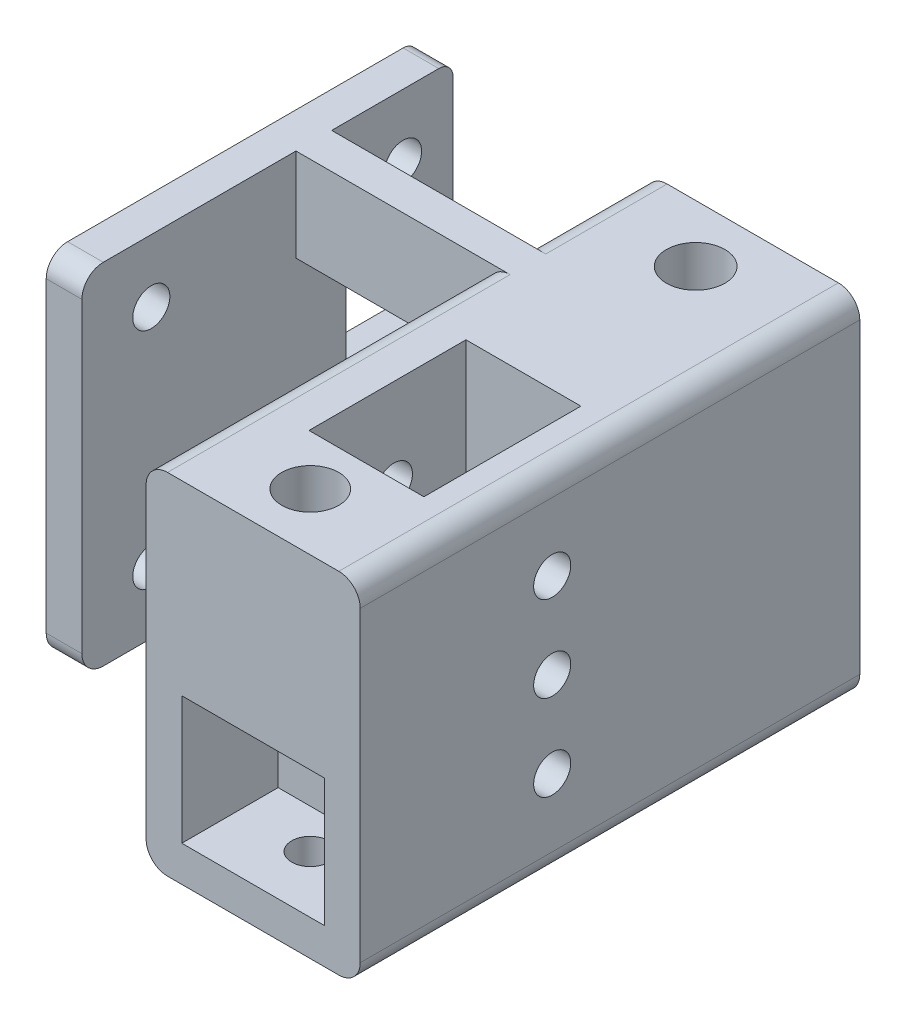
from build123d import *

# Parameters (mm, degrees)
SKETCH1_R            = 11
BOSS_EXTRUDE1_DEPTH  = 3
SKETCH2_R            = 5.25
CUT_EXTRUDE1_DEPTH   = 16.842979518
SKETCH3_R            = 1.5
SKETCH3_R_2          = 1.545696852
CUT_EXTRUDE2_DEPTH   = 16.842979518
SKETCH4_W            = 27.859055967
SKETCH4_H            = 2.012088195
BOSS_EXTRUDE3_DEPTH  = 11
SKETCH5_R            = 5.25
CUT_EXTRUDE3_DEPTH   = 31.019585245
SKETCH6_R            = 1.5
SKETCH6_R_2          = 1.545696852
CUT_EXTRUDE4_DEPTH   = 31.101943449
CUT_EXTRUDE5_DEPTH   = 10
BOSS_EXTRUDE5_START  = 5
SKETCH10_R           = 1.5
SKETCH10_R_2         = 5.25
SKETCH10_R_3         = 1.545696852
BOSS_EXTRUDE5_DEPTH  = 5
SKETCH11_W           = 18
SKETCH11_H           = 7.012088195
BOSS_EXTRUDE7_DEPTH  = 13
SKETCH13_W           = 6
SKETCH13_H           = 8
BOSS_EXTRUDE8_DEPTH  = 10
SKETCH14_W           = 18
SKETCH14_H           = 1.5
CUT_EXTRUDE6_DEPTH   = 10
SKETCH15_W           = 8
SKETCH15_H           = 8
BOSS_EXTRUDE9_DEPTH  = 30
SKETCH16_W           = 2
SKETCH16_H           = 8
BOSS_EXTRUDE10_DEPTH = 10
SKETCH18_W           = 47.012088195
SKETCH18_H           = 3.5
BOSS_EXTRUDE11_DEPTH = 8
SKETCH19_W           = 47.012088195
SKETCH19_H           = 5
BOSS_EXTRUDE12_DEPTH = 8
SKETCH20_R           = 2.75
CUT_EXTRUDE7_DEPTH   = 8
SKETCH21_W           = 30
SKETCH21_H           = 16.5
CUT_EXTRUDE8_DEPTH   = 8
BOSS_EXTRUDE13_DEPTH = 2
FILLET4_R            = 2
SKETCH24_W           = 18
SKETCH24_H           = 7.012088195
BOSS_EXTRUDE14_DEPTH = 13.5
SKETCH25_W           = 10.228009428
SKETCH25_H           = 18.5
BOSS_EXTRUDE15_DEPTH = 8
SKETCH26_R           = 2.6
CUT_EXTRUDE9_DEPTH   = 8
FILLET6_R            = 2
SKETCH27_W           = 8.492399871
SKETCH27_H           = 8.837619377
BOSS_EXTRUDE16_DEPTH = 8
SKETCH28_W           = 9.389970589
SKETCH28_H           = 7.249609645
BOSS_EXTRUDE17_DEPTH = 8
SKETCH30_W           = 8
SKETCH30_H           = 2
BOSS_EXTRUDE19_DEPTH = 8
SKETCH31_W           = 8
SKETCH31_H           = 2
BOSS_EXTRUDE20_DEPTH = 8
SKETCH32_W           = 8
SKETCH32_H           = 18.5
BOSS_EXTRUDE22_DEPTH = 5
SKETCH33_W           = 8
SKETCH33_H           = 18.5
BOSS_EXTRUDE23_DEPTH = 5
SKETCH34_R           = 2.6
CUT_EXTRUDE11_DEPTH  = 46.033658305
SKETCH35_R           = 2.6
CUT_EXTRUDE12_DEPTH  = 46.033658305
SKETCH36_W           = 8
SKETCH36_H           = 0.228009428
CUT_EXTRUDE13_DEPTH  = 57.389541409
SKETCH37_W           = 3
SKETCH37_H           = 18.5
CUT_EXTRUDE14_DEPTH  = 15
SKETCH38_W           = 3
SKETCH38_H           = 18.5
CUT_EXTRUDE15_DEPTH  = 15
FILLET9_R            = 2
SKETCH39_W           = 8.423355969
SKETCH39_H           = 9.735190095
SKETCH39_W_2         = 8.630487673
SKETCH39_H_2         = 8.354312067
BOSS_EXTRUDE24_DEPTH = 8
SKETCH40_R           = 2.6
CUT_EXTRUDE16_DEPTH  = 8
SKETCH41_W           = 3
SKETCH41_H           = 9.735190095
CUT_EXTRUDE18_DEPTH  = 9
SKETCH42_W           = 3
SKETCH42_H           = 8.354312067
CUT_EXTRUDE19_DEPTH  = 9
SKETCH43_R           = 2.6
CUT_EXTRUDE20_DEPTH  = 9
SKETCH48_W           = 22
SKETCH48_H           = 13
BOSS_EXTRUDE26_DEPTH = 5
SKETCH49_W           = 22
SKETCH49_H           = 13
BOSS_EXTRUDE27_DEPTH = 5
SKETCH50_W           = 5
SKETCH50_H           = 49
BOSS_EXTRUDE28_DEPTH = 15
SKETCH51_W           = 55
SKETCH51_H           = 5
BOSS_EXTRUDE29_DEPTH = 42.8
SKETCH52_W           = 55
SKETCH52_H           = 5
BOSS_EXTRUDE30_DEPTH = 47.8
SKETCH53_W           = 55
SKETCH53_H           = 5
BOSS_EXTRUDE31_DEPTH = 47.8
SKETCH55_W           = 15
SKETCH55_H           = 47.8
CUT_EXTRUDE21_DEPTH  = 128.298389621
SKETCH57_W           = 47.8
SKETCH57_H           = 52.8
BOSS_EXTRUDE32_DEPTH = 5
SKETCH58_R           = 11.5
CUT_EXTRUDE25_DEPTH  = 111.385370407
SKETCH61_W           = 25
SKETCH61_H           = 27.8
CUT_EXTRUDE26_DEPTH  = 128.298389621
SKETCH62_R           = 1.75
CUT_EXTRUDE28_DEPTH  = 108.656537191
SKETCH63_R           = 1.75
CUT_EXTRUDE29_DEPTH  = 108.656537191
SKETCH64_R           = 1.75
CUT_EXTRUDE30_DEPTH  = 108.656537191
SKETCH65_R           = 1.75
CUT_EXTRUDE31_DEPTH  = 108.656537191
SKETCH67_W           = 5
SKETCH67_H           = 49
BOSS_EXTRUDE33_DEPTH = 5
SKETCH68_W           = 15
SKETCH68_H           = 17.012088195
SKETCH68_H_2         = 47.8
BOSS_EXTRUDE34_DEPTH = 15
BOSS_EXTRUDE36_DEPTH = 15
SKETCH70_R           = 4.1
CUT_EXTRUDE32_DEPTH  = 10
SKETCH72_W           = 18
SKETCH72_H           = 22
CUT_EXTRUDE33_DEPTH  = 139.003188369
FILLET10_R           = 4
FILLET12_R           = 4
FILLET13_R           = 4
SKETCH77_W           = 36.444620244
SKETCH77_H           = 50.862269336
CUT_EXTRUDE38_DEPTH  = 122.625059146
SKETCH78_W           = 45
SKETCH78_H           = 47.8
CUT_EXTRUDE39_DEPTH  = 119.630223805
SKETCH79_W           = 31.43111071
SKETCH79_H           = 18.51831177
CUT_EXTRUDE40_DEPTH  = 110.889216941
SKETCH80_W           = 62
SKETCH80_H           = 47.8
CUT_EXTRUDE41_DEPTH  = 110.889216941
SKETCH81_R           = 11
CUT_EXTRUDE42_DEPTH  = 86.776387285
SKETCH85_W           = 30
SKETCH85_H           = 49
BOSS_EXTRUDE37_DEPTH = 17
SKETCH86_W           = 30
SKETCH86_H           = 49
BOSS_EXTRUDE39_DEPTH = 70
SKETCH87_R           = 4.1
SKETCH87_R_2         = 4
SKETCH87_W           = 16.099872219
SKETCH87_H           = 22
CUT_EXTRUDE43_DEPTH  = 70
FILLET17_R           = 3
SKETCH89_W           = 5
SKETCH89_H           = 49
BOSS_EXTRUDE40_DEPTH = 30
SKETCH92_R           = 2.6
CUT_EXTRUDE44_DEPTH  = 10
FILLET18_R           = 3
SKETCH93_W           = 20
SKETCH93_H           = 17.946512219
CUT_EXTRUDE45_DEPTH  = 17.8
SKETCH98_R           = 2.6
CUT_EXTRUDE46_DEPTH  = 37.8
SKETCH99_R           = 2.6
CUT_EXTRUDE48_DEPTH  = 37.8
SKETCH100_R          = 2.6
CUT_EXTRUDE49_DEPTH  = 37.8
SKETCH102_W          = 20
SKETCH102_H          = 17.9
CUT_EXTRUDE50_DEPTH  = 13.5
SKETCH103_W          = 11.73949016
SKETCH103_H          = 10.259722493
BOSS_EXTRUDE41_DEPTH = 5
SKETCH104_W          = 13.021955472
SKETCH104_H          = 9.865117781
BOSS_EXTRUDE42_DEPTH = 5
SKETCH105_R          = 2.6
CUT_EXTRUDE51_DEPTH  = 15


with BuildPart() as part:
    # Sketch1 → Boss-Extrude1 (new body)
    with BuildSketch(Plane.XY):
        Circle(SKETCH1_R)
    extrude(amount=BOSS_EXTRUDE1_DEPTH)

    # Sketch2 → Cut-Extrude1 (cut, through all)
    with BuildSketch(Plane.XY.offset(3)):
        Circle(SKETCH2_R)
    extrude(amount=-CUT_EXTRUDE1_DEPTH, mode=Mode.SUBTRACT)

    # Sketch3 → Cut-Extrude2 (cut, through all)
    with BuildSketch(Plane.XY.offset(3)):
        with Locations((0, 8.5)):
            Circle(SKETCH3_R)
        with Locations((-8.5, 0)):
            Circle(SKETCH3_R)
        with Locations((0, -8.5)):
            Circle(SKETCH3_R_2)
        with Locations((8.5, 0)):
            Circle(SKETCH3_R)
    extrude(amount=-CUT_EXTRUDE2_DEPTH, mode=Mode.SUBTRACT)

    # Sketch4 → Boss-Extrude3 (add, symmetric)
    with BuildSketch(Plane(origin=(0, 0, 0), x_dir=(1, 0, 0), z_dir=(0, 1, 0))):
        with Locations((13.929527984, -1.993955902)):
            Rectangle(SKETCH4_W, SKETCH4_H)
    extrude(amount=BOSS_EXTRUDE3_DEPTH, both=True)

    # Sketch5 → Cut-Extrude3 (cut, through all)
    with BuildSketch(Plane(origin=(0, 0, 0.987911805), x_dir=(-1, 0, 0), z_dir=(0, 0, -1))):
        with Locations(Location((0, 0, 0), (0, 0, 180))):
            Circle(SKETCH5_R)
    extrude(amount=-CUT_EXTRUDE3_DEPTH, mode=Mode.SUBTRACT)

    # Sketch6 → Cut-Extrude4 (cut, through all)
    with BuildSketch(Plane(origin=(0, 0, 0), x_dir=(-1, 0, 0), z_dir=(0, 0, -1))):
        with Locations(Location((-8.5, 0, 0), (0, 0, 180))):
            Circle(SKETCH6_R)
        with Locations(Location((0, 8.5, 0), (0, 0, 180))):
            Circle(SKETCH6_R)
        with Locations(Location((0, -8.5, 0), (0, 0, 180))):
            Circle(SKETCH6_R_2)
    extrude(amount=-CUT_EXTRUDE4_DEPTH, mode=Mode.SUBTRACT)

    # Sketch7 → Cut-Extrude5 (cut)
    with BuildSketch(Plane(origin=(0, 0, 0.987911805), x_dir=(-1, 0, 0), z_dir=(0, 0, -1))):
        Polygon((-24, 11), (-27.859055967, 11), (-27.859055967, -11), (-24, -11), (-24, 0), align=None)
    extrude(amount=-CUT_EXTRUDE5_DEPTH, mode=Mode.SUBTRACT)

    # Sketch10 → Boss-Extrude5 (add)
    with BuildSketch(Plane.XY.offset(3).offset(BOSS_EXTRUDE5_START)):
        with BuildLine():
            Line((0, -11), (24, -11))
            Line((24, -11), (24, 11))
            Line((24, 11), (0, 11))
            ThreePointArc((0, 11), (-11, 0), (0, -11))
        make_face()
        with Locations((0, 8.5)):
            Circle(SKETCH10_R, mode=Mode.SUBTRACT)
        Circle(SKETCH10_R_2, mode=Mode.SUBTRACT)
        with Locations((0, -8.5)):
            Circle(SKETCH10_R_3, mode=Mode.SUBTRACT)
        with Locations((8.5, 0)):
            Circle(SKETCH10_R, mode=Mode.SUBTRACT)
        with Locations((-8.5, 0)):
            Circle(SKETCH10_R, mode=Mode.SUBTRACT)
    extrude(amount=-BOSS_EXTRUDE5_DEPTH)

    # Sketch11 → Boss-Extrude7 (add)
    with BuildSketch(Plane.XZ.offset(11)):
        with Locations((15, 4.493955902)):
            Rectangle(SKETCH11_W, SKETCH11_H)
    extrude(amount=BOSS_EXTRUDE7_DEPTH)

    # Sketch13 → Boss-Extrude8 (add)
    with BuildSketch(Plane(origin=(0, 0, 0.987911805), x_dir=(-1, 0, 0), z_dir=(0, 0, -1))):
        with Locations((-21, -18.5)):
            Rectangle(SKETCH13_W, SKETCH13_H)
    extrude(amount=BOSS_EXTRUDE8_DEPTH)

    # Sketch14 → Cut-Extrude6 (cut)
    with BuildSketch(Plane(origin=(0, 0, 0.987911805), x_dir=(-1, 0, 0), z_dir=(0, 0, -1))):
        with Locations((-15, -23.25)):
            Rectangle(SKETCH14_W, SKETCH14_H)
    extrude(amount=-CUT_EXTRUDE6_DEPTH, mode=Mode.SUBTRACT)

    # Sketch15 → Boss-Extrude9 (add)
    with BuildSketch(Plane.XY.offset(8)):
        with Locations((20, -18.5)):
            Rectangle(SKETCH15_W, SKETCH15_H)
    extrude(amount=BOSS_EXTRUDE9_DEPTH)

    # Sketch16 → Boss-Extrude10 (add)
    with BuildSketch(Plane(origin=(0, 0, 0.987911805), x_dir=(-1, 0, 0), z_dir=(0, 0, -1))):
        with Locations((-17, -18.5)):
            Rectangle(SKETCH16_W, SKETCH16_H)
    extrude(amount=BOSS_EXTRUDE10_DEPTH)

    # Sketch18 → Boss-Extrude11 (add)
    with BuildSketch(Plane(origin=(24, 0, 0), x_dir=(0, 0, -1), z_dir=(1, 0, 0))):
        with Locations((-14.493955902, -12.75)):
            Rectangle(SKETCH18_W, SKETCH18_H)
    extrude(amount=-BOSS_EXTRUDE11_DEPTH)

    # Sketch19 → Boss-Extrude12 (add)
    with BuildSketch(Plane(origin=(24, 0, 0), x_dir=(0, 0, -1), z_dir=(1, 0, 0))):
        with Locations((-14.493955902, -8.5)):
            Rectangle(SKETCH19_W, SKETCH19_H)
    extrude(amount=-BOSS_EXTRUDE12_DEPTH)

    # Sketch20 → Cut-Extrude7 (cut)
    with BuildSketch(Plane(origin=(24, 0, 0), x_dir=(0, 0, -1), z_dir=(1, 0, 0))):
        with Locations((2.797809472, -17)):
            Circle(SKETCH20_R)
    extrude(amount=-CUT_EXTRUDE7_DEPTH, mode=Mode.SUBTRACT)

    # Sketch21 → Cut-Extrude8 (cut)
    with BuildSketch(Plane(origin=(24, 0, 0), x_dir=(0, 0, -1), z_dir=(1, 0, 0))):
        with Locations((-23, -14.25)):
            Rectangle(SKETCH21_W, SKETCH21_H)
    extrude(amount=-CUT_EXTRUDE8_DEPTH, mode=Mode.SUBTRACT)

    # Sketch22 → Boss-Extrude13 (add)
    with BuildSketch(Plane.XZ.offset(22.5)):
        Polygon((6, 8), (24, 8), (24, -9.012088195), (16, -9.012088195), (16, 0.987911805), (6, 0.987911805), align=None)
    extrude(amount=BOSS_EXTRUDE13_DEPTH)

    # Fillet4
    fillet4_edges = [part.edges().sort_by_distance(p)[0] for p in [
        (20, -6, -9.012088195),
        (20, -24.5, -9.012088195),
    ]]
    fillet(fillet4_edges, radius=FILLET4_R)

    # Sketch24 → Boss-Extrude14 (add)
    with BuildSketch(Plane(origin=(0, 11, 0), x_dir=(1, 0, 0), z_dir=(0, 1, 0))):
        with Locations((15, -4.493955902)):
            Rectangle(SKETCH24_W, SKETCH24_H)
    extrude(amount=BOSS_EXTRUDE14_DEPTH)

    # Sketch25 → Boss-Extrude15 (add)
    with BuildSketch(Plane(origin=(24, 0, 0), x_dir=(0, 0, -1), z_dir=(1, 0, 0))):
        with Locations((4.126092909, 15.25)):
            Rectangle(SKETCH25_W, SKETCH25_H)
    extrude(amount=-BOSS_EXTRUDE15_DEPTH)

    # Sketch26 → Cut-Extrude9 (cut)
    with BuildSketch(Plane(origin=(24, 0, 0), x_dir=(0, 0, -1), z_dir=(1, 0, 0))):
        with Locations((2.797809472, 17)):
            Circle(SKETCH26_R)
    extrude(amount=-CUT_EXTRUDE9_DEPTH, mode=Mode.SUBTRACT)

    # Fillet6
    fillet6_edges = [part.edges().sort_by_distance(p)[0] for p in [
        (20, 24.5, -9.240097623),
        (20, 6, -9.240097623),
    ]]
    fillet(fillet6_edges, radius=FILLET6_R)

    # Sketch27 → Boss-Extrude16 (add)
    with BuildSketch(Plane(origin=(24, 0, 0), x_dir=(0, 0, -1), z_dir=(1, 0, 0))):
        with Locations((2.277102445, 17.019321692)):
            Rectangle(SKETCH27_W, SKETCH27_H)
    extrude(amount=-BOSS_EXTRUDE16_DEPTH)

    # Sketch28 → Boss-Extrude17 (add)
    with BuildSketch(Plane(origin=(24, 0, 0), x_dir=(0, 0, -1), z_dir=(1, 0, 0))):
        with Locations((2.173536592, -16.501492431)):
            Rectangle(SKETCH28_W, SKETCH28_H)
    extrude(amount=-BOSS_EXTRUDE17_DEPTH)

    # Sketch30 → Boss-Extrude19 (add)
    with BuildSketch(Plane(origin=(0, 0, -9.240097623), x_dir=(-1, 0, 0), z_dir=(0, 0, -1))):
        with Locations((-20, 23.5)):
            Rectangle(SKETCH30_W, SKETCH30_H)
        with Locations((-20, 7)):
            Rectangle(SKETCH30_W, SKETCH30_H)
    extrude(amount=-BOSS_EXTRUDE19_DEPTH)

    # Sketch31 → Boss-Extrude20 (add)
    with BuildSketch(Plane(origin=(0, 0, -9.012088195), x_dir=(-1, 0, 0), z_dir=(0, 0, -1))):
        with Locations((-20, -7)):
            Rectangle(SKETCH31_W, SKETCH31_H)
        with Locations((-20, -23.5)):
            Rectangle(SKETCH31_W, SKETCH31_H)
    extrude(amount=-BOSS_EXTRUDE20_DEPTH)

    # Sketch32 → Boss-Extrude22 (add)
    with BuildSketch(Plane(origin=(0, 0, -9.240097623), x_dir=(-1, 0, 0), z_dir=(0, 0, -1))):
        with Locations((-20, 15.25)):
            Rectangle(SKETCH32_W, SKETCH32_H)
    extrude(amount=BOSS_EXTRUDE22_DEPTH)

    # Sketch33 → Boss-Extrude23 (add)
    with BuildSketch(Plane(origin=(0, 0, -9.012088195), x_dir=(-1, 0, 0), z_dir=(0, 0, -1))):
        with Locations((-20, -15.25)):
            Rectangle(SKETCH33_W, SKETCH33_H)
    extrude(amount=BOSS_EXTRUDE23_DEPTH)

    # Sketch34 → Cut-Extrude11 (cut, through all)
    with BuildSketch(Plane(origin=(24, 0, 0), x_dir=(0, 0, -1), z_dir=(1, 0, 0))):
        with Locations((6.012088195, 16.7)):
            Circle(SKETCH34_R)
    extrude(amount=-CUT_EXTRUDE11_DEPTH, mode=Mode.SUBTRACT)

    # Sketch35 → Cut-Extrude12 (cut, through all)
    with BuildSketch(Plane(origin=(24, 0, 0), x_dir=(0, 0, -1), z_dir=(1, 0, 0))):
        with Locations((6.012088195, -16.7)):
            Circle(SKETCH35_R)
    extrude(amount=-CUT_EXTRUDE12_DEPTH, mode=Mode.SUBTRACT)

    # Sketch36 → Cut-Extrude13 (cut, through all)
    with BuildSketch(Plane.XZ.offset(24.5)):
        with Locations((20, -14.126092909)):
            Rectangle(SKETCH36_W, SKETCH36_H)
    extrude(amount=-CUT_EXTRUDE13_DEPTH, mode=Mode.SUBTRACT)

    # Sketch37 → Cut-Extrude14 (cut)
    with BuildSketch(Plane(origin=(0, 0, -14.012088195), x_dir=(-1, 0, 0), z_dir=(0, 0, -1))):
        with Locations((-17.5, -15.25)):
            Rectangle(SKETCH37_W, SKETCH37_H)
    extrude(amount=-CUT_EXTRUDE14_DEPTH, mode=Mode.SUBTRACT)

    # Sketch38 → Cut-Extrude15 (cut)
    with BuildSketch(Plane(origin=(0, 0, -14.012088195), x_dir=(-1, 0, 0), z_dir=(0, 0, -1))):
        with Locations((-17.5, 15.25)):
            Rectangle(SKETCH38_W, SKETCH38_H)
    extrude(amount=-CUT_EXTRUDE15_DEPTH, mode=Mode.SUBTRACT)

    # Fillet9
    fillet9_edges = [part.edges().sort_by_distance(p)[0] for p in [
        (21.5, -24.5, -14.012088195),
        (21.5, 6, -14.012088195),
        (21.5, 24.5, -14.012088195),
        (21.5, -6, -14.012088195),
    ]]
    fillet(fillet9_edges, radius=FILLET9_R)

    # Sketch39 → Boss-Extrude24 (add)
    with BuildSketch(Plane(origin=(24, 0, 0), x_dir=(0, 0, -1), z_dir=(1, 0, 0))):
        with Locations((6.768936723, 16.708624135)):
            Rectangle(SKETCH39_W, SKETCH39_H)
        with Locations((6.11301966, -16.846711938)):
            Rectangle(SKETCH39_W_2, SKETCH39_H_2)
    extrude(amount=-BOSS_EXTRUDE24_DEPTH)

    # Sketch40 → Cut-Extrude16 (cut)
    with BuildSketch(Plane(origin=(24, 0, 0), x_dir=(0, 0, -1), z_dir=(1, 0, 0))):
        with Locations((7, 15.7)):
            Circle(SKETCH40_R)
    extrude(amount=-CUT_EXTRUDE16_DEPTH, mode=Mode.SUBTRACT)

    # Sketch41 → Cut-Extrude18 (cut)
    with BuildSketch(Plane(origin=(0, 0, -10.980614707), x_dir=(-1, 0, 0), z_dir=(0, 0, -1))):
        with Locations((-17.5, 16.708624135)):
            Rectangle(SKETCH41_W, SKETCH41_H)
    extrude(amount=-CUT_EXTRUDE18_DEPTH, mode=Mode.SUBTRACT)

    # Sketch42 → Cut-Extrude19 (cut)
    with BuildSketch(Plane(origin=(0, 0, -10.428263496), x_dir=(-1, 0, 0), z_dir=(0, 0, -1))):
        with Locations((-17.5, -16.846711938)):
            Rectangle(SKETCH42_W, SKETCH42_H)
    extrude(amount=-CUT_EXTRUDE19_DEPTH, mode=Mode.SUBTRACT)

    # Sketch43 → Cut-Extrude20 (cut)
    with BuildSketch(Plane(origin=(24, 0, 0), x_dir=(0, 0, -1), z_dir=(1, 0, 0))):
        with Locations((7, -15.7)):
            Circle(SKETCH43_R)
    extrude(amount=-CUT_EXTRUDE20_DEPTH, mode=Mode.SUBTRACT)

    # Sketch48 → Boss-Extrude26 (add)
    with BuildSketch(Plane.XY.offset(8)):
        with Locations((35, -18)):
            Rectangle(SKETCH48_W, SKETCH48_H)
    extrude(amount=-BOSS_EXTRUDE26_DEPTH)

    # Sketch49 → Boss-Extrude27 (add)
    with BuildSketch(Plane.XY.offset(8)):
        with Locations((35, 18)):
            Rectangle(SKETCH49_W, SKETCH49_H)
    extrude(amount=-BOSS_EXTRUDE27_DEPTH)

    # Sketch50 → Boss-Extrude28 (add)
    with BuildSketch(Plane(origin=(46, 0, 0), x_dir=(0, 0, -1), z_dir=(1, 0, 0))):
        with Locations((-5.5, 0)):
            Rectangle(SKETCH50_W, SKETCH50_H)
    extrude(amount=BOSS_EXTRUDE28_DEPTH)

    # Sketch51 → Boss-Extrude29 (add)
    with BuildSketch(Plane.XY.offset(8)):
        with Locations((33.5, 22)):
            Rectangle(SKETCH51_W, SKETCH51_H)
    extrude(amount=BOSS_EXTRUDE29_DEPTH)

    # Sketch52 → Boss-Extrude30 (add)
    with BuildSketch(Plane.XZ.offset(-19.5)):
        with Locations((33.5, 53.3)):
            Rectangle(SKETCH52_W, SKETCH52_H)
    extrude(amount=-BOSS_EXTRUDE30_DEPTH)

    # Sketch53 → Boss-Extrude31 (add)
    with BuildSketch(Plane.XY.offset(55.8)):
        with Locations((33.5, 69.8)):
            Rectangle(SKETCH53_W, SKETCH53_H)
    extrude(amount=-BOSS_EXTRUDE31_DEPTH)

    # Sketch55 → Cut-Extrude21 (cut, through all)
    with BuildSketch(Plane(origin=(0, 72.3, 0), x_dir=(1, 0, 0), z_dir=(0, 1, 0))):
        with Locations((53.5, -31.9)):
            Rectangle(SKETCH55_W, SKETCH55_H)
    extrude(amount=-CUT_EXTRUDE21_DEPTH, mode=Mode.SUBTRACT)

    # Sketch57 → Boss-Extrude32 (add)
    with BuildSketch(Plane(origin=(46, 0, 0), x_dir=(0, 0, -1), z_dir=(1, 0, 0))):
        with Locations((-31.9, 45.9)):
            Rectangle(SKETCH57_W, SKETCH57_H)
    extrude(amount=BOSS_EXTRUDE32_DEPTH)

    # Sketch58 → Cut-Extrude25 (cut, through all)
    with BuildSketch(Plane(origin=(51, 0, 0), x_dir=(0, 0, -1), z_dir=(1, 0, 0))):
        with Locations((-29.4, 45.9)):
            Circle(SKETCH58_R)
    extrude(amount=-CUT_EXTRUDE25_DEPTH, mode=Mode.SUBTRACT)

    # Sketch61 → Cut-Extrude26 (cut, through all)
    with BuildSketch(Plane(origin=(0, 72.3, 0), x_dir=(1, 0, 0), z_dir=(0, 1, 0))):
        with Locations((28.5, -31.9)):
            Rectangle(SKETCH61_W, SKETCH61_H)
    extrude(amount=-CUT_EXTRUDE26_DEPTH, mode=Mode.SUBTRACT)

    # Sketch62 → Cut-Extrude28 (cut, through all)
    with BuildSketch(Plane.ZY.offset(-46)):
        with Locations((46.3, 29)):
            Circle(SKETCH62_R)
    extrude(amount=-CUT_EXTRUDE28_DEPTH, mode=Mode.SUBTRACT)

    # Sketch63 → Cut-Extrude29 (cut, through all)
    with BuildSketch(Plane.ZY.offset(-46)):
        with Locations((12.5, 29)):
            Circle(SKETCH63_R)
    extrude(amount=-CUT_EXTRUDE29_DEPTH, mode=Mode.SUBTRACT)

    # Sketch64 → Cut-Extrude30 (cut, through all)
    with BuildSketch(Plane.ZY.offset(-46)):
        with Locations((46.3, 62.8)):
            Circle(SKETCH64_R)
    extrude(amount=-CUT_EXTRUDE30_DEPTH, mode=Mode.SUBTRACT)

    # Sketch65 → Cut-Extrude31 (cut, through all)
    with BuildSketch(Plane.ZY.offset(-46)):
        with Locations((12.5, 62.8)):
            Circle(SKETCH65_R)
    extrude(amount=-CUT_EXTRUDE31_DEPTH, mode=Mode.SUBTRACT)

    # Sketch67 → Boss-Extrude33 (add)
    with BuildSketch(Plane(origin=(61, 0, 0), x_dir=(0, 0, -1), z_dir=(1, 0, 0))):
        with Locations((-5.5, 0)):
            Rectangle(SKETCH67_W, SKETCH67_H)
    extrude(amount=BOSS_EXTRUDE33_DEPTH)

    # Sketch68 → Boss-Extrude34 (add)
    with BuildSketch(Plane.XZ.offset(24.5)):
        with Locations((58.5, -5.506044098)):
            Rectangle(SKETCH68_W, SKETCH68_H)
        with Locations((58.5, 31.9)):
            Rectangle(SKETCH68_W, SKETCH68_H_2)
    extrude(amount=-BOSS_EXTRUDE34_DEPTH)

    # Sketch69 → Boss-Extrude36 (add)
    with BuildSketch(Plane(origin=(66, 0, 0), x_dir=(0, 0, -1), z_dir=(1, 0, 0))):
        Polygon((-55.8, -9.5), (-8, -9.5), (-8, 24.5), (-3, 24.5), (-3, -9.5), (14.012088195, -9.5), (14.012088195, -24.5), (-55.8, -24.5), align=None)
    extrude(amount=BOSS_EXTRUDE36_DEPTH)

    # Sketch70 → Cut-Extrude32 (cut)
    with BuildSketch(Plane.XZ.offset(24.5)):
        with Locations(Location((66, 47.8, 0), (0, 0, 270))):
            Circle(SKETCH70_R)
        with Locations(Location((66, -6.012088195, 0), (0, 0, 270))):
            Circle(SKETCH70_R)
    extrude(amount=-CUT_EXTRUDE32_DEPTH, mode=Mode.SUBTRACT)

    # Sketch72 → Cut-Extrude33 (cut, through all)
    with BuildSketch(Plane.XZ.offset(24.5)):
        with Locations((66, 29)):
            Rectangle(SKETCH72_W, SKETCH72_H)
    extrude(amount=-CUT_EXTRUDE33_DEPTH, mode=Mode.SUBTRACT)

    # Fillet10
    fillet10_edges = [part.edges().sort_by_distance(p)[0] for p in [
        (81, 24.5, 5.5),
    ]]
    fillet(fillet10_edges, radius=FILLET10_R)

    # Fillet12
    fillet12_edges = [part.edges().sort_by_distance(p)[0] for p in [
        (6, -24.5, 4.493955903),
    ]]
    fillet(fillet12_edges, radius=FILLET12_R)

    # Fillet13
    fillet13_edges = [part.edges().sort_by_distance(p)[0] for p in [
        (51, -9.5, 31.9),
        (51, -24.5, 31.9),
        (81, -24.5, 20.893955903),
        (81, -17, -14.012088195),
        (81, -9.5, -5.506044097),
        (81, -9.5, 31.9),
        (51, -9.5, -5.506044097),
        (51, -17, -14.012088195),
        (51, -24.5, -5.506044097),
    ]]
    fillet(fillet13_edges, radius=FILLET13_R)

    # Sketch77 → Cut-Extrude38 (cut, through all)
    with BuildSketch(Plane(origin=(0, 0, 0.987911805), x_dir=(-1, 0, 0), z_dir=(0, 0, -1))):
        with Locations((-0.777689878, -0.931134668)):
            Rectangle(SKETCH77_W, SKETCH77_H)
    extrude(amount=-CUT_EXTRUDE38_DEPTH, mode=Mode.SUBTRACT)


with BuildPart() as cut_extrude38_piece_1:
    # of the separate pieces the step leaves, piece 1, a body of its own (cut_extrude38_pieces)
    add(part.part.solids().sort_by_distance((55, -24.5, 8))[0])

    # Sketch78 → Cut-Extrude39 (cut, through all)
    with BuildSketch(Plane(origin=(0, 0, 8), x_dir=(-1, 0, 0), z_dir=(0, 0, -1))):
        with Locations((-28.5, 48.4)):
            Rectangle(SKETCH78_W, SKETCH78_H)
    extrude(amount=-CUT_EXTRUDE39_DEPTH, mode=Mode.SUBTRACT)

    # Sketch79 → Cut-Extrude40 (cut, through all)
    with BuildSketch(Plane.XZ.offset(24.5)):
        with Locations((66.715555355, -6.259155885)):
            Rectangle(SKETCH79_W, SKETCH79_H)
    extrude(amount=-CUT_EXTRUDE40_DEPTH, mode=Mode.SUBTRACT)

    # Sketch80 → Cut-Extrude41 (cut, through all)
    with BuildSketch(Plane(origin=(0, 24.5, 0), x_dir=(1, 0, 0), z_dir=(0, 1, 0))):
        with Locations((50, -31.9)):
            Rectangle(SKETCH80_W, SKETCH80_H)
    extrude(amount=-CUT_EXTRUDE41_DEPTH, mode=Mode.SUBTRACT)

    # Sketch85 → Boss-Extrude37 (add)
    with BuildSketch(Plane(origin=(0, 0, 3), x_dir=(-1, 0, 0), z_dir=(0, 0, -1))):
        with Locations((-66, 0)):
            Rectangle(SKETCH85_W, SKETCH85_H)
    extrude(amount=BOSS_EXTRUDE37_DEPTH)

    # Sketch86 → Boss-Extrude39 (add)
    with BuildSketch(Plane(origin=(0, 0, -14), x_dir=(-1, 0, 0), z_dir=(0, 0, -1))):
        with Locations((-66, 0)):
            Rectangle(SKETCH86_W, SKETCH86_H)
    extrude(amount=-BOSS_EXTRUDE39_DEPTH)

    # Sketch87 → Cut-Extrude43 (cut)
    with BuildSketch(Plane(origin=(0, 24.5, 0), x_dir=(1, 0, 0), z_dir=(0, 1, 0))):
        with Locations(Location((66, 6, 0), (0, 0, 270))):
            Circle(SKETCH87_R)
        with Locations(Location((66, -48, 0), (0, 0, 270))):
            Circle(SKETCH87_R_2)
        with Locations((66.869351407, -30)):
            Rectangle(SKETCH87_W, SKETCH87_H)
    extrude(amount=-CUT_EXTRUDE43_DEPTH, mode=Mode.SUBTRACT)

    # Fillet17
    fillet17_edges = [cut_extrude38_piece_1.edges().sort_by_distance(p)[0] for p in [
        (81, 24.5, 21),
        (81, -24.5, 21),
        (51, 24.5, -5.5),
        (51, 24.5, 32),
        (51, -24.5, 32),
    ]]
    fillet(fillet17_edges, radius=FILLET17_R)

    # Sketch89 → Boss-Extrude40 (add)
    with BuildSketch(Plane.XY.offset(8)):
        with Locations((21.5, 0)):
            Rectangle(SKETCH89_W, SKETCH89_H)
    extrude(amount=BOSS_EXTRUDE40_DEPTH)

    # Sketch92 → Cut-Extrude44 (cut)
    with BuildSketch(Plane.ZY.offset(-19)):
        with Locations(Location((28.273964411, 15.7, 0), (0, 0, 270))):
            Circle(SKETCH92_R)
        with Locations(Location((28.273964411, -15.7, 0), (0, 0, 270))):
            Circle(SKETCH92_R)
    extrude(amount=-CUT_EXTRUDE44_DEPTH, mode=Mode.SUBTRACT)

    # Fillet18
    fillet18_edges = [cut_extrude38_piece_1.edges().sort_by_distance(p)[0] for p in [
        (21.5, -24.5, 38),
        (21.5, 24.5, 38),
    ]]
    fillet(fillet18_edges, radius=FILLET18_R)

    # Sketch93 → Cut-Extrude45 (cut)
    with BuildSketch(Plane(origin=(0, 0, -14), x_dir=(-1, 0, 0), z_dir=(0, 0, -1))):
        with Locations((-66, -10.526743891)):
            Rectangle(SKETCH93_W, SKETCH93_H)
    extrude(amount=-CUT_EXTRUDE45_DEPTH, mode=Mode.SUBTRACT)

    # Sketch98 → Cut-Extrude46 (cut)
    with BuildSketch(Plane(origin=(81, 0, 0), x_dir=(0, 0, -1), z_dir=(1, 0, 0))):
        with Locations((-29.1, 0)):
            Circle(SKETCH98_R)
    extrude(amount=-CUT_EXTRUDE46_DEPTH, mode=Mode.SUBTRACT)

    # Sketch99 → Cut-Extrude48 (cut)
    with BuildSketch(Plane(origin=(81, 0, 0), x_dir=(0, 0, -1), z_dir=(1, 0, 0))):
        with Locations((-29.1, 12)):
            Circle(SKETCH99_R)
    extrude(amount=-CUT_EXTRUDE48_DEPTH, mode=Mode.SUBTRACT)

    # Sketch100 → Cut-Extrude49 (cut)
    with BuildSketch(Plane(origin=(81, 0, 0), x_dir=(0, 0, -1), z_dir=(1, 0, 0))):
        with Locations((-29.1, -12)):
            Circle(SKETCH100_R)
    extrude(amount=-CUT_EXTRUDE49_DEPTH, mode=Mode.SUBTRACT)

    # Sketch102 → Cut-Extrude50 (cut)
    with BuildSketch(Plane.XY.offset(56)):
        with Locations((66, -10.55)):
            Rectangle(SKETCH102_W, SKETCH102_H)
    extrude(amount=-CUT_EXTRUDE50_DEPTH, mode=Mode.SUBTRACT)

    # Sketch103 → Boss-Extrude41 (add)
    with BuildSketch(Plane.XZ.offset(24.5)):
        with Locations((66.178793162, 47.77775068)):
            Rectangle(SKETCH103_W, SKETCH103_H)
    extrude(amount=-BOSS_EXTRUDE41_DEPTH)

    # Sketch104 → Boss-Extrude42 (add)
    with BuildSketch(Plane.XZ.offset(24.5)):
        with Locations((66.228118751, -6.381745942)):
            Rectangle(SKETCH104_W, SKETCH104_H)
    extrude(amount=-BOSS_EXTRUDE42_DEPTH)

    # Sketch105 → Cut-Extrude51 (cut)
    with BuildSketch(Plane.XZ.offset(24.5)):
        with Locations(Location((66, 48, 0), (0, 0, 270))):
            Circle(SKETCH105_R)
        with Locations(Location((66, -6, 0), (0, 0, 270))):
            Circle(SKETCH105_R)
    extrude(amount=-CUT_EXTRUDE51_DEPTH, mode=Mode.SUBTRACT)


with BuildPart() as cut_extrude38_piece_2:
    # of the separate pieces the step leaves, piece 2, a body of its own (cut_extrude38_pieces)
    add(part.part.solids().sort_by_distance((11, 0, 0))[0])

    # Sketch81 → Cut-Extrude42 (cut, through all)
    with BuildSketch(Plane(origin=(0, 0, 0), x_dir=(-1, 0, 0), z_dir=(0, 0, -1))):
        Circle(SKETCH81_R)
    extrude(amount=-CUT_EXTRUDE42_DEPTH, mode=Mode.SUBTRACT)


solid = cut_extrude38_piece_1.part
